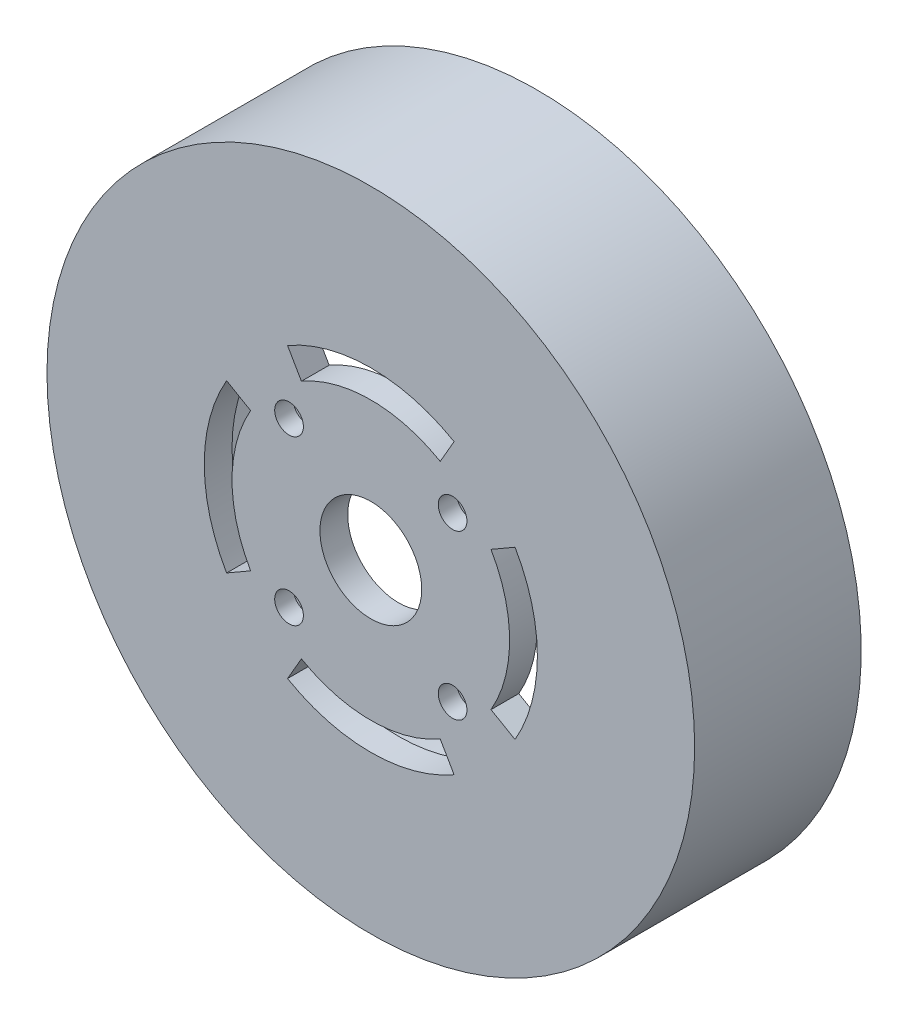
from build123d import *

# Parameters (mm, degrees)
SKETCH_2_R          = 35
SKETCH_2_R_2        = 5.5
EXTRUDE_1_DEPTH     = 5
EXTRUDE_START       = 15
SKETCH_3_R          = 35
SKETCH_3_R_2        = 30.1
EXTRUDE_2_DEPTH     = 15
SKETCH_4_R          = 1.55
CUT_EXTRUDE_1_DEPTH = 10
CUT_EXTRUDE_5_DEPTH = 15
FILLET_1_R          = 1
CUT_EXTRUDE_START   = -2
SKETCH_10_R         = 35
CUT_EXTRUDE_6_DEPTH = 2
CUT_EXTRUDE_7_DEPTH = 10
SKETCH5_R           = 1.55
CUT_EXTRUDE2_DEPTH  = 2


with BuildPart() as part:
    # 草图2 → 凸台-拉伸1 (new body)
    with BuildSketch(Plane.XY):
        Circle(SKETCH_2_R)
        Circle(SKETCH_2_R_2, mode=Mode.SUBTRACT)
    extrude(amount=EXTRUDE_1_DEPTH)

    # 草图3 → 凸台-拉伸2 (add)
    with BuildSketch(Plane(origin=(0, 0, 0), x_dir=(-1, 0, 0), z_dir=(0, 0, -1)).offset(EXTRUDE_START)):
        Circle(SKETCH_3_R)
        Circle(SKETCH_3_R_2, mode=Mode.SUBTRACT)
    extrude(amount=-EXTRUDE_2_DEPTH)

    # 草图4 → 切除-拉伸1 (cut)
    with BuildSketch(Plane(origin=(0, 0, -15), x_dir=(-1, 0, 0), z_dir=(0, 0, -1))):
        with Locations((0, 32.5)):
            Circle(SKETCH_4_R)
        with Locations((32.5, 0)):
            Circle(SKETCH_4_R)
        with Locations((0, -32.5)):
            Circle(SKETCH_4_R)
        with Locations((-32.5, 0)):
            Circle(SKETCH_4_R)
    extrude(amount=-CUT_EXTRUDE_1_DEPTH, mode=Mode.SUBTRACT)

    # 草图9 → 切除-拉伸5 (cut)
    with BuildSketch(Plane(origin=(0, 0, -15), x_dir=(-1, 0, 0), z_dir=(0, 0, -1))):
        with BuildLine():
            ThreePointArc((-22.013313369, 20.528615017), (-22.026376234, 22.026376234), (-20.528615017, 22.013313369))
            ThreePointArc((-20.528615017, 22.013313369), (-21.283914114, 21.283914114), (-22.013313369, 20.528615017))
        make_face()
        with BuildLine():
            ThreePointArc((20.528615017, 22.013313369), (22.026376234, 22.026376234), (22.013313369, 20.528615017))
            ThreePointArc((22.013313369, 20.528615017), (21.283914114, 21.283914114), (20.528615017, 22.013313369))
        make_face()
        with BuildLine():
            ThreePointArc((22.013313369, -20.528615017), (22.026376234, -22.026376234), (20.528615017, -22.013313369))
            ThreePointArc((20.528615017, -22.013313369), (21.283914114, -21.283914114), (22.013313369, -20.528615017))
        make_face()
        with BuildLine():
            ThreePointArc((-20.528615017, -22.013313369), (-22.026376234, -22.026376234), (-22.013313369, -20.528615017))
            ThreePointArc((-22.013313369, -20.528615017), (-21.283914114, -21.283914114), (-20.528615017, -22.013313369))
        make_face()
    extrude(amount=-CUT_EXTRUDE_5_DEPTH, mode=Mode.SUBTRACT)

    # 圆角1
    # the kernel refuses this fillet: 1 mm, written as the material it takes off along each edge
    with BuildSketch(Plane(origin=(0, 0, -15), x_dir=(-0.7403558797037455, 0.6722151228498904, 0), z_dir=(-0.6722151228498904, -0.7403558797037455, 0))) as fillet_1_piece_1:
        with BuildLine():
            CenterArc((30.1 + FILLET_1_R, -FILLET_1_R), FILLET_1_R, 90, 90)
            Line((30.1, -FILLET_1_R), (30.1, 0))
            Line((30.1, 0), (30.1 + FILLET_1_R, 0))
        make_face()
    revolve(axis=Axis((0, 0, -15), (0, 0, -1)), revolution_arc=95.523479776, mode=Mode.SUBTRACT)
    with BuildSketch(Plane(origin=(0, 0, -15), x_dir=(0.6722151228498918, 0.7403558797037441, 0), z_dir=(-0.7403558797037441, 0.6722151228498918, 0))) as fillet_1_piece_2:
        with BuildLine():
            CenterArc((30.1 + FILLET_1_R, -FILLET_1_R), FILLET_1_R, 90, 90)
            Line((30.1, -FILLET_1_R), (30.1, 0))
            Line((30.1, 0), (30.1 + FILLET_1_R, 0))
        make_face()
    revolve(axis=Axis((0, 0, -15), (0, 0, -1)), revolution_arc=95.523479776, mode=Mode.SUBTRACT)
    with BuildSketch(Plane(origin=(0, 0, -15), x_dir=(0.7403558797037453, -0.6722151228498905, 0), z_dir=(0.6722151228498905, 0.7403558797037453, 0))) as fillet_1_piece_3:
        with BuildLine():
            CenterArc((30.1 + FILLET_1_R, -FILLET_1_R), FILLET_1_R, 90, 90)
            Line((30.1, -FILLET_1_R), (30.1, 0))
            Line((30.1, 0), (30.1 + FILLET_1_R, 0))
        make_face()
    revolve(axis=Axis((0, 0, -15), (0, 0, -1)), revolution_arc=95.523479776, mode=Mode.SUBTRACT)
    with BuildSketch(Plane(origin=(0, 0, -15), x_dir=(-1, 0, 0), z_dir=(0, -1, 0))) as fillet_1_piece_4:
        with BuildLine():
            CenterArc((30.1 + FILLET_1_R, -FILLET_1_R), FILLET_1_R, 90, 90)
            Line((30.1, -FILLET_1_R), (30.1, 0))
            Line((30.1, 0), (30.1 + FILLET_1_R, 0))
        make_face()
    revolve(axis=Axis((0, 0, -15), (0, 0, -1)), revolution_arc=47.760430641, mode=Mode.SUBTRACT)
    with BuildSketch(Plane(origin=(0, 0, -15), x_dir=(-0.6722320403041436, -0.7403405189428228, 0), z_dir=(0.7403405189428228, -0.6722320403041436, 0))) as fillet_1_piece_5:
        with BuildLine():
            CenterArc((30.1 + FILLET_1_R, -FILLET_1_R), FILLET_1_R, 90, 90)
            Line((30.1, -FILLET_1_R), (30.1, 0))
            Line((30.1, 0), (30.1 + FILLET_1_R, 0))
        make_face()
    revolve(axis=Axis((0, 0, -15), (0, 0, -1)), revolution_arc=47.760430641, mode=Mode.SUBTRACT)

    # 草图10 → 切除-拉伸6 (cut)
    with BuildSketch(Plane.XY.offset(5).offset(CUT_EXTRUDE_START)):
        with Locations(Location((0, 0, 0), (0, 0, 180))):
            Circle(SKETCH_10_R)
    extrude(amount=CUT_EXTRUDE_6_DEPTH, mode=Mode.SUBTRACT)

    # 草图11 → 切除-拉伸7 (cut)
    with BuildSketch(Plane(origin=(0, 0, 0), x_dir=(-1, 0, 0), z_dir=(0, 0, -1))):
        with BuildLine():
            Line((12.990381057, 7.5), (15.588457268, 9))
            ThreePointArc((15.588457268, 9), (18, 0), (15.588457268, -9))
            Line((15.588457268, -9), (12.990381057, -7.5))
            ThreePointArc((12.990381057, -7.5), (15, 0), (12.990381057, 7.5))
        make_face()
        with BuildLine():
            Line((-7.5, 12.990381057), (-9, 15.588457268))
            ThreePointArc((-9, 15.588457268), (0, 18), (9, 15.588457268))
            Line((9, 15.588457268), (7.5, 12.990381057))
            ThreePointArc((7.5, 12.990381057), (0, 15), (-7.5, 12.990381057))
        make_face()
        with BuildLine():
            Line((7.5, -12.990381057), (9, -15.588457268))
            ThreePointArc((9, -15.588457268), (0, -18), (-9, -15.588457268))
            Line((-9, -15.588457268), (-7.5, -12.990381057))
            ThreePointArc((-7.5, -12.990381057), (0, -15), (7.5, -12.990381057))
        make_face()
        with BuildLine():
            Line((-12.990381057, -7.5), (-15.588457268, -9))
            ThreePointArc((-15.588457268, -9), (-18, 0), (-15.588457268, 9))
            Line((-15.588457268, 9), (-12.990381057, 7.5))
            ThreePointArc((-12.990381057, 7.5), (-15, 0), (-12.990381057, -7.5))
        make_face()
    extrude(amount=-CUT_EXTRUDE_7_DEPTH, mode=Mode.SUBTRACT)

    # Sketch5 → Cut-Extrude2 (cut)
    with BuildSketch(Plane.XY.offset(3)):
        with Locations((8.838834765, 8.838834765)):
            Circle(SKETCH5_R)
        with Locations((8.838834765, -8.838834765)):
            Circle(SKETCH5_R)
        with Locations((-8.838834765, -8.838834765)):
            Circle(SKETCH5_R)
        with Locations((-8.838834765, 8.838834765)):
            Circle(SKETCH5_R)
    extrude(amount=-CUT_EXTRUDE2_DEPTH, mode=Mode.SUBTRACT)


solid = part.part
